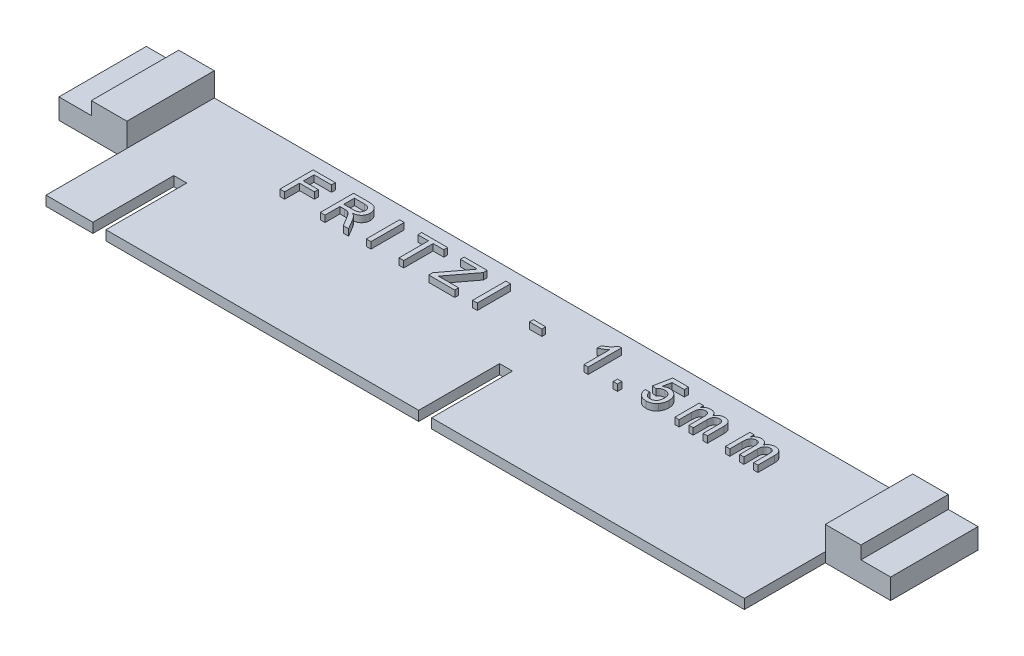
from build123d import *

# Parameters (mm, degrees)
BOSS_EXTRUDE1_DEPTH = 1.5
SKETCH2_W           = 10.09
SKETCH2_H           = 13.5
BOSS_EXTRUDE2_DEPTH = 1.65
SKETCH3_W           = 10.5
SKETCH3_H           = 13.5
BOSS_EXTRUDE3_DEPTH = 1.65
SKETCH6_W           = 5.497902349
SKETCH6_H           = 13.5
BOSS_EXTRUDE4_DEPTH = 2
SKETCH7_W           = 5.501620936
SKETCH7_H           = 13.5
BOSS_EXTRUDE5_DEPTH = 2
WRAP4_OUTLINE_W     = 0.724397578
WRAP4_OUTLINE_H     = 5.13663737
WRAP4_OUTLINE_W_2   = 0.658543252
WRAP4_OUTLINE_H_2   = 0.658543252
WRAP4_OUTLINE_W_3   = 1.909775433
WRAP4_OUTLINE_H_3   = 0.592688927
WRAP4_DEPTH         = 1


# Read off the part's stored shape, not the designer's step: Wrap4
with BuildPart() as part:
    # Sketch1 → Boss-Extrude1 (new body)
    with BuildSketch(Plane(origin=(0, 0, 0), x_dir=(1, 0, 0), z_dir=(0, 1, 0))):
        Polygon((0, 0), (128.5, 0), (128.5, -13.5), (118.41, -13.5), (118.41, -26), (70.08, -26), (70.08, -13.5), (68.08, -13.5), (68.08, -26), (19.75, -26), (19.75, -13.5), (17.75, -13.5), (17.75, -26), (10.5, -26), (10.5, -13.5), (0, -13.5), align=None)
    extrude(amount=BOSS_EXTRUDE1_DEPTH)

    # Sketch2 → Boss-Extrude2 (add)
    with BuildSketch(Plane(origin=(0, 1.5, 0), x_dir=(1, 0, 0), z_dir=(0, 1, 0))):
        with Locations((123.455, -6.75)):
            Rectangle(SKETCH2_W, SKETCH2_H)
    extrude(amount=BOSS_EXTRUDE2_DEPTH)

    # Sketch3 → Boss-Extrude3 (add)
    with BuildSketch(Plane(origin=(0, 1.5, 0), x_dir=(1, 0, 0), z_dir=(0, 1, 0))):
        with Locations((5.25, -6.75)):
            Rectangle(SKETCH3_W, SKETCH3_H)
    extrude(amount=BOSS_EXTRUDE3_DEPTH)

    # Sketch6 → Boss-Extrude4 (add)
    with BuildSketch(Plane(origin=(0, 3.15, 0), x_dir=(1, 0, 0), z_dir=(0, 1, 0))):
        with Locations((7.751048825, -6.75)):
            Rectangle(SKETCH6_W, SKETCH6_H)
    extrude(amount=BOSS_EXTRUDE4_DEPTH)

    # Sketch7 → Boss-Extrude5 (add)
    with BuildSketch(Plane(origin=(0, 3.15, 0), x_dir=(1, 0, 0), z_dir=(0, 1, 0))):
        with Locations((121.160810468, -6.75)):
            Rectangle(SKETCH7_W, SKETCH7_H)
    extrude(amount=BOSS_EXTRUDE5_DEPTH)

    # Wrap4 outline → Wrap4 (add)
    # profile 1 of 12: a face of its own
    with BuildSketch(Plane(origin=(0, 1.5, 0), x_dir=(1, 0, 0), z_dir=(0, 1, 0))):
        with BuildLine():
            add(Edge.make_bspline(
                [(37.232087747, -2.980118824), (37.284568157, -2.98053003), (37.386137849, -2.981325871), (37.533434874, -2.986959518), (37.670921881, -2.999104184), (37.798851661, -3.012236948), (37.917201486, -3.032393986), (38.025849258, -3.055513653), (38.124962722, -3.083026406), (38.214984976, -3.115521089), (38.298505999, -3.152283955), (38.375923678, -3.197643396), (38.450456167, -3.247347671), (38.519337305, -3.305742778), (38.584383838, -3.369680014), (38.645535481, -3.440028151), (38.70188693, -3.517397669), (38.771389695, -3.628129494), (38.84595199, -3.775600966), (38.908074094, -3.964332497), (38.948129316, -4.161752567), (38.952415339, -4.296666315), (38.954589942, -4.365117602)],
                knots=[0, 0, 0, 0, 0.062112751, 0.120211959, 0.174385121, 0.225443756, 0.272358213, 0.316388163, 0.356869479, 0.393978324, 0.429589372, 0.464683041, 0.500036346, 0.535482748, 0.571363467, 0.607908532, 0.645662299, 0.68451734, 0.762578622, 0.840497289, 0.919072993, 1, 1, 1, 1], degree=3))
            Line((37.232087747, -2.980118824), (35.003330427, -2.980118824))
            Line((35.003330427, -2.980118824), (35.003330427, -8.116756194))
            Line((35.003330427, -8.116756194), (35.727728004, -8.116756194))
            Line((35.727728004, -8.116756194), (35.727728004, -5.81185481))
            Line((35.727728004, -5.81185481), (36.469618137, -5.81185481))
            add(Edge.make_bspline(
                [(36.826672057, -5.835521208), (36.805793105, -5.831756024), (36.758125833, -5.823159995), (36.677186923, -5.817545914), (36.579119504, -5.811587319), (36.508048375, -5.811760932), (36.469618137, -5.81185481)],
                knots=[0, 0, 0, 0, 0.177494657, 0.405225623, 0.678388108, 1, 1, 1, 1], degree=3))
            add(Edge.make_bspline(
                [(37.905036633, -7.032217775), (37.882024667, -6.994165441), (37.837431254, -6.920426266), (37.773017668, -6.81273375), (37.709862264, -6.713585631), (37.651286707, -6.6201482), (37.594913903, -6.534117768), (37.541288545, -6.455195483), (37.491886427, -6.382345986), (37.430695517, -6.297530214), (37.35947946, -6.203680775), (37.276375209, -6.107033575), (37.197235321, -6.02997805), (37.09977309, -5.954416911), (36.979051371, -5.883742166), (36.876435632, -5.851269063), (36.826672057, -5.835521208)],
                knots=[0, 0, 0, 0, 0.080781471, 0.156541226, 0.227934987, 0.294310317, 0.356867864, 0.414758559, 0.467641397, 0.516748422, 0.604729742, 0.681570653, 0.748109542, 0.8049411, 0.90540605, 1, 1, 1, 1], degree=3))
            Line((37.905036633, -7.032217775), (38.545058357, -8.116756194))
            Line((38.545058357, -8.116756194), (39.375440239, -8.116756194))
            Line((39.375440239, -8.116756194), (38.532710671, -6.698830254))
            add(Edge.make_bspline(
                [(37.991470435, -5.999128048), (38.03999496, -6.046696262), (38.139667781, -6.144404755), (38.277021257, -6.31083094), (38.41019017, -6.496088821), (38.491100326, -6.62997532), (38.532710671, -6.698830254)],
                knots=[0, 0, 0, 0, 0.22952757, 0.471465934, 0.728186348, 1, 1, 1, 1], degree=3))
            add(Edge.make_bspline(
                [(37.592228588, -5.746000485), (37.633583206, -5.766891926), (37.712117113, -5.806565523), (37.820848281, -5.86877338), (37.913015928, -5.93233448), (37.966413317, -5.977795248), (37.991470435, -5.999128048)],
                knots=[0, 0, 0, 0, 0.293076243, 0.556562337, 0.791913609, 1, 1, 1, 1], degree=3))
            add(Edge.make_bspline(
                [(38.954589942, -4.365117602), (38.953584791, -4.409057224), (38.95159955, -4.49584099), (38.9363924, -4.623436355), (38.90887629, -4.745348596), (38.873592302, -4.862645397), (38.825299287, -4.973664851), (38.769353926, -5.080674564), (38.700045577, -5.180734694), (38.622447216, -5.276509681), (38.533462705, -5.365948281), (38.43230925, -5.445823769), (38.31998956, -5.517671931), (38.195974656, -5.579510447), (38.061692074, -5.636033787), (37.915456937, -5.681549103), (37.757859436, -5.718715849), (37.648605523, -5.736713422), (37.592228588, -5.746000485)],
                knots=[0, 0, 0, 0, 0.061413069, 0.121295023, 0.179224042, 0.235938095, 0.292216833, 0.348196639, 0.404444739, 0.462025534, 0.520334212, 0.580382902, 0.641825905, 0.70636321, 0.773851394, 0.845266257, 0.920154676, 1, 1, 1, 1], degree=3))
        make_face()
        with BuildLine():
            add(Edge.make_bspline(
                [(37.103466018, -5.219165883), (37.172450733, -5.218086552), (37.301411188, -5.216068843), (37.481741982, -5.198839732), (37.635423942, -5.171461944), (37.765495142, -5.131528232), (37.87477548, -5.07608698), (37.969818667, -5.008521454), (38.048800752, -4.923888599), (38.114505688, -4.828398441), (38.165579482, -4.723316289), (38.202421681, -4.612942895), (38.226535542, -4.498205875), (38.228962627, -4.420117448), (38.230192364, -4.38055221)],
                knots=[0, 0, 0, 0, 0.128860268, 0.240892185, 0.338044202, 0.420120485, 0.494058457, 0.566094784, 0.636804954, 0.709148449, 0.781941806, 0.854285301, 0.926170407, 1, 1, 1, 1], degree=3))
            Line((37.103466018, -5.219165883), (35.727728004, -5.219165883))
            Line((35.727728004, -5.219165883), (35.727728004, -3.572807752))
            Line((35.727728004, -3.572807752), (37.258841066, -3.572807752))
            add(Edge.make_bspline(
                [(38.230192364, -4.38055221), (38.229236295, -4.351719516), (38.227363637, -4.29524474), (38.217546542, -4.212355447), (38.19845978, -4.13359146), (38.173255757, -4.058536424), (38.139578067, -3.987740062), (38.099570346, -3.920653781), (38.051828784, -3.8576494), (37.997143572, -3.798534999), (37.934355011, -3.744746671), (37.862635712, -3.69833901), (37.782551323, -3.65890251), (37.694008757, -3.627603068), (37.597286941, -3.602568609), (37.491835257, -3.58591399), (37.37813596, -3.573862764), (37.299348941, -3.573165993), (37.258841066, -3.572807752)],
                knots=[0, 0, 0, 0, 0.060325529, 0.118159991, 0.174186676, 0.229538818, 0.283449815, 0.337826512, 0.392632103, 0.448465576, 0.505965409, 0.565058532, 0.626654479, 0.692232033, 0.761131078, 0.835309877, 0.91532556, 1, 1, 1, 1], degree=3))
        make_face(mode=Mode.SUBTRACT)
    # profile 2 of 12: a face of its own
    with BuildSketch(Plane(origin=(0, 1.5, 0), x_dir=(1, 0, 0), z_dir=(0, 1, 0))):
        with BuildLine():
            add(Edge.make_bspline(
                [(54.28588845, -4.162409757), (54.328869665, -4.106240627), (54.411287551, -3.998534479), (54.52769542, -3.842905303), (54.635307308, -3.703597601), (54.702027272, -3.614721343), (54.733492067, -3.572807752)],
                knots=[0, 0, 0, 0, 0.286630334, 0.549623057, 0.787604526, 1, 1, 1, 1], degree=3))
            Line((54.28588845, -4.162409757), (51.756670771, -7.499371895))
            Line((51.756670771, -7.499371895), (51.756670771, -8.116756194))
            Line((51.756670771, -8.116756194), (55.773784612, -8.116756194))
            Line((55.773784612, -8.116756194), (55.773784612, -7.524067267))
            Line((55.773784612, -7.524067267), (52.64776211, -7.524067267))
            Line((52.64776211, -7.524067267), (52.897802751, -7.193766667))
            Line((52.897802751, -7.193766667), (55.642075961, -3.572807752))
            Line((55.642075961, -3.572807752), (55.642075961, -2.980118824))
            Line((55.642075961, -2.980118824), (52.085942397, -2.980118824))
            Line((52.085942397, -2.980118824), (52.085942397, -3.572807752))
            Line((52.085942397, -3.572807752), (54.733492067, -3.572807752))
        make_face()
    # profile 3 of 12: a face of its own
    with BuildSketch(Plane(origin=(0, 1.5, 0), x_dir=(1, 0, 0), z_dir=(0, 1, 0))):
        with BuildLine():
            add(Edge.make_bspline(
                [(75.727645163, -4.114047987), (75.689726185, -4.150616177), (75.610915743, -4.226619152), (75.477695017, -4.33418234), (75.329003661, -4.443202191), (75.166772527, -4.548036965), (75.001405331, -4.646727599), (74.841599226, -4.735484652), (74.690022243, -4.810594654), (74.590177666, -4.8516651), (74.542267309, -4.871372728)],
                knots=[0, 0, 0, 0, 0.1116703, 0.232094481, 0.362743459, 0.50255751, 0.641525103, 0.771098495, 0.890161757, 1, 1, 1, 1], degree=3))
            Line((75.727645163, -4.114047987), (75.727645163, -8.116756194))
            Line((75.727645163, -8.116756194), (76.386188416, -8.116756194))
            Line((76.386188416, -8.116756194), (76.386188416, -2.980118824))
            Line((76.386188416, -2.980118824), (75.962251197, -2.980118824))
            add(Edge.make_bspline(
                [(74.542267309, -4.264278167), (74.624558299, -4.221898142), (74.786748967, -4.138369624), (75.015889309, -3.994104389), (75.229816467, -3.837714936), (75.4249891, -3.669235889), (75.599948929, -3.497020059), (75.747390118, -3.323247522), (75.870759522, -3.154288028), (75.932656289, -3.036457519), (75.962251197, -2.980118824)],
                knots=[0, 0, 0, 0, 0.142657251, 0.281168994, 0.416977192, 0.550852493, 0.67836417, 0.795032443, 0.901998178, 1, 1, 1, 1], degree=3))
            Line((74.542267309, -4.264278167), (74.542267309, -4.871372728))
        make_face()
    # profile 4 of 12: a face of its own
    with BuildSketch(Plane(origin=(0, 1.5, 0), x_dir=(1, 0, 0), z_dir=(0, 1, 0))):
        with BuildLine():
            add(Edge.make_bspline(
                [(84.459928692, -6.667961039), (84.466449304, -6.705066337), (84.479132909, -6.777241912), (84.503302919, -6.881718198), (84.534692882, -6.978779589), (84.569962962, -7.06926669), (84.611887402, -7.152222714), (84.65731288, -7.228957494), (84.710882947, -7.296747184), (84.767204681, -7.359137248), (84.829022087, -7.414113929), (84.896931657, -7.460461167), (84.96903867, -7.500896326), (85.046221362, -7.534002838), (85.128598024, -7.558235061), (85.215120222, -7.57739859), (85.306902086, -7.587055001), (85.369524225, -7.588953843), (85.401439748, -7.589921592)],
                knots=[0, 0, 0, 0, 0.077361337, 0.150479832, 0.219977237, 0.286680997, 0.349678494, 0.410679625, 0.469427114, 0.526755701, 0.583141981, 0.638824428, 0.69526347, 0.752695805, 0.810849183, 0.871356304, 0.934436431, 1, 1, 1, 1], degree=3))
            Line((84.459928692, -6.667961039), (83.80138544, -6.733815364))
            add(Edge.make_bspline(
                [(85.397323853, -8.182610519), (85.342046321, -8.181489224), (85.233912372, -8.179295744), (85.075585031, -8.160226672), (84.924997008, -8.129818226), (84.782101125, -8.086203101), (84.646466875, -8.031091309), (84.519670831, -7.961080436), (84.399512583, -7.880992357), (84.288635212, -7.788359574), (84.187611491, -7.685038409), (84.097092186, -7.573218014), (84.018302268, -7.452825475), (83.951279766, -7.324581193), (83.895419606, -7.188608159), (83.852684375, -7.043978304), (83.818834515, -6.892110671), (83.807262784, -6.787133721), (83.80138544, -6.733815364)],
                knots=[0, 0, 0, 0, 0.069298023, 0.135560844, 0.199670956, 0.261716238, 0.32266193, 0.382906924, 0.443032033, 0.503500787, 0.563724281, 0.623980022, 0.683629387, 0.743848272, 0.805191846, 0.867648743, 0.932778084, 1, 1, 1, 1], degree=3))
            add(Edge.make_bspline(
                [(86.701033698, -7.559052377), (86.660683807, -7.608803255), (86.581311238, -7.706668572), (86.443878502, -7.833691896), (86.296136362, -7.94164424), (86.137205587, -8.029347696), (85.968153131, -8.099824849), (85.78690223, -8.146724749), (85.59564299, -8.178219889), (85.46433981, -8.181126839), (85.397323853, -8.182610519)],
                knots=[0, 0, 0, 0, 0.127892619, 0.251578514, 0.37279282, 0.492777699, 0.613590069, 0.737808649, 0.866179902, 1, 1, 1, 1], degree=3))
            add(Edge.make_bspline(
                [(87.094101702, -6.355152994), (87.092935688, -6.412138125), (87.090632477, -6.52470002), (87.07175719, -6.690580781), (87.040664639, -6.850419951), (86.999040293, -7.004690862), (86.942800217, -7.152517376), (86.874586267, -7.294376983), (86.795897651, -7.431749942), (86.732793464, -7.516432442), (86.701033698, -7.559052377)],
                knots=[0, 0, 0, 0, 0.132461622, 0.261649501, 0.387546698, 0.510781629, 0.632675361, 0.754660354, 0.87652278, 1, 1, 1, 1], degree=3))
            add(Edge.make_bspline(
                [(85.586655038, -4.692331281), (85.638518088, -4.693690134), (85.740649012, -4.696366045), (85.891142465, -4.718352025), (86.035039521, -4.755674684), (86.173468898, -4.805942864), (86.304605242, -4.872581923), (86.429776871, -4.953267674), (86.548478422, -5.048665187), (86.660038843, -5.156974507), (86.761228581, -5.277209238), (86.851796699, -5.40544809), (86.925767791, -5.544258052), (86.987982556, -5.69001477), (87.034906264, -5.845110896), (87.070522996, -6.007345298), (87.089566081, -6.178746276), (87.092566166, -6.295430443), (87.094101702, -6.355152994)],
                knots=[0, 0, 0, 0, 0.061997419, 0.122087954, 0.181375311, 0.239508008, 0.297835698, 0.356879971, 0.417281825, 0.479640409, 0.542500067, 0.60496242, 0.666991033, 0.730216243, 0.794172863, 0.860458143, 0.92857818, 1, 1, 1, 1], degree=3))
            add(Edge.make_bspline(
                [(84.670868328, -5.034979567), (84.707204981, -5.007712033), (84.778564419, -4.95416291), (84.889872353, -4.884047392), (85.002771873, -4.824944686), (85.116605763, -4.776544539), (85.232278255, -4.73884091), (85.349091326, -4.71264617), (85.467442707, -4.694942223), (85.546804288, -4.693204077), (85.586655038, -4.692331281)],
                knots=[0, 0, 0, 0, 0.136729402, 0.268514917, 0.395529405, 0.519999954, 0.640496477, 0.761236102, 0.880106717, 1, 1, 1, 1], degree=3))
            Line((84.670868328, -5.034979567), (84.932227681, -3.704516402))
            Line((84.932227681, -3.704516402), (86.830684401, -3.704516402))
            Line((86.830684401, -3.704516402), (86.830684401, -3.04597315))
            Line((86.830684401, -3.04597315), (84.394074367, -3.04597315))
            Line((84.394074367, -3.04597315), (83.867239765, -5.68014616))
            Line((83.867239765, -5.68014616), (84.525783017, -5.746000485))
            add(Edge.make_bspline(
                [(85.40452667, -5.285020208), (85.353314748, -5.286518257), (85.255101871, -5.289391176), (85.113980066, -5.31356001), (84.985511777, -5.352601683), (84.871151519, -5.410788547), (84.76897628, -5.480302313), (84.676863423, -5.558960293), (84.594053385, -5.646709307), (84.548628708, -5.71277413), (84.525783017, -5.746000485)],
                knots=[0, 0, 0, 0, 0.147859637, 0.283561322, 0.412369396, 0.534236356, 0.652691629, 0.768663059, 0.883652402, 1, 1, 1, 1], degree=3))
            add(Edge.make_bspline(
                [(86.43555845, -6.394253999), (86.434802473, -6.352379978), (86.433330412, -6.270841548), (86.420933252, -6.152108036), (86.400017784, -6.040462603), (86.372955127, -5.934674721), (86.335652668, -5.836397456), (86.29140985, -5.744205884), (86.23721054, -5.66005658), (86.17691023, -5.581329442), (86.108039664, -5.510753735), (86.029668411, -5.451161489), (85.944870929, -5.39900624), (85.851939311, -5.356711586), (85.750818833, -5.325288247), (85.642514355, -5.301110816), (85.525902056, -5.288394477), (85.44571197, -5.286165171), (85.40452667, -5.285020208)],
                knots=[0, 0, 0, 0, 0.072865933, 0.141886872, 0.207452626, 0.27043768, 0.331640872, 0.390107577, 0.448069287, 0.505502952, 0.562488153, 0.619084329, 0.676415531, 0.73545236, 0.796240769, 0.860405678, 0.928304927, 1, 1, 1, 1], degree=3))
            add(Edge.make_bspline(
                [(85.401439748, -7.589921592), (85.440592946, -7.588975537), (85.51715873, -7.587125486), (85.628547442, -7.571478493), (85.733763102, -7.545678414), (85.832302268, -7.50957312), (85.925320122, -7.464671915), (86.009730853, -7.406533033), (86.090136999, -7.341179186), (86.161364406, -7.263264857), (86.226201359, -7.178442095), (86.282160523, -7.085854442), (86.329270234, -6.98680144), (86.36893146, -6.881302078), (86.398218382, -6.768753675), (86.419761279, -6.649754967), (86.433590959, -6.524230152), (86.434893319, -6.438193762), (86.43555845, -6.394253999)],
                knots=[0, 0, 0, 0, 0.065801038, 0.128676796, 0.188675875, 0.247598437, 0.30484942, 0.361785899, 0.419522706, 0.478681815, 0.538769503, 0.598799056, 0.660184282, 0.722951531, 0.787992689, 0.855403768, 0.926153061, 1, 1, 1, 1], degree=3))
        make_face()
    # profile 5 of 12: a face of its own
    with BuildSketch(Plane(origin=(0, 1.5, 0), x_dir=(1, 0, 0), z_dir=(0, 1, 0))):
        with BuildLine():
            add(Edge.make_bspline(
                [(90.447733216, -4.948545765), (90.476723239, -4.901063826), (90.533920459, -4.807382117), (90.640002493, -4.682214873), (90.757638125, -4.570285777), (90.888267986, -4.473016481), (91.031674921, -4.394320962), (91.185815313, -4.337326372), (91.350061132, -4.303612122), (91.462486911, -4.299371708), (91.519923949, -4.297205329)],
                knots=[0, 0, 0, 0, 0.126604642, 0.249790539, 0.372524359, 0.496014844, 0.619831372, 0.743965703, 0.869195023, 1, 1, 1, 1], degree=3))
            Line((90.447733216, -4.948545765), (90.447733216, -4.363059655))
            Line((90.447733216, -4.363059655), (89.789189963, -4.363059655))
            Line((89.789189963, -4.363059655), (89.789189963, -8.116756194))
            Line((89.789189963, -8.116756194), (90.447733216, -8.116756194))
            Line((90.447733216, -8.116756194), (90.447733216, -6.204922814))
            add(Edge.make_bspline(
                [(91.330592764, -4.889894257), (91.288588619, -4.891246221), (91.205407596, -4.893923522), (91.083929913, -4.922390355), (90.967126463, -4.965849773), (90.856538413, -5.026251305), (90.754817901, -5.102943027), (90.668285592, -5.198594017), (90.597128949, -5.310131821), (90.550101533, -5.41455339), (90.52031038, -5.507244038), (90.50110931, -5.585345371), (90.484771617, -5.67054308), (90.471682199, -5.763305315), (90.459905556, -5.86307666), (90.453684115, -5.970610598), (90.447632981, -6.085152472), (90.447699049, -6.164096924), (90.447733216, -6.204922814)],
                knots=[0, 0, 0, 0, 0.069873516, 0.138370882, 0.206732215, 0.277064656, 0.347591873, 0.41798234, 0.490745669, 0.567227227, 0.608072941, 0.652844181, 0.701152527, 0.752556338, 0.808915673, 0.868486814, 0.931988344, 1, 1, 1, 1], degree=3))
            add(Edge.make_bspline(
                [(91.962382697, -5.722334087), (91.962134017, -5.688702266), (91.961653786, -5.623755159), (91.953820311, -5.529364802), (91.943339345, -5.441238055), (91.926585259, -5.359859524), (91.906417342, -5.284951053), (91.88039988, -5.216968381), (91.850843391, -5.154551486), (91.815611477, -5.098614368), (91.775602282, -5.048772598), (91.729452052, -5.005921969), (91.67774561, -4.96945988), (91.619216954, -4.94074589), (91.555261986, -4.918236513), (91.485592826, -4.901885103), (91.410152735, -4.891212913), (91.357727736, -4.890344002), (91.330592764, -4.889894257)],
                knots=[0, 0, 0, 0, 0.084109515, 0.16242563, 0.236821856, 0.305986647, 0.370107802, 0.430667946, 0.48785122, 0.542607322, 0.595676743, 0.647283062, 0.699654171, 0.753378583, 0.809829663, 0.868937728, 0.932162686, 1, 1, 1, 1], degree=3))
            Line((91.962382697, -5.722334087), (91.962382697, -8.116756194))
            Line((91.962382697, -8.116756194), (92.620925949, -8.116756194))
            Line((92.620925949, -8.116756194), (92.620925949, -5.97546165))
            add(Edge.make_bspline(
                [(93.497611654, -4.889894257), (93.46669128, -4.89061869), (93.405967946, -4.892041376), (93.317228409, -4.90519748), (93.232024674, -4.923899301), (93.1517043, -4.953463308), (93.074727138, -4.989638419), (93.001548223, -5.033604489), (92.933211686, -5.087188157), (92.868348552, -5.14738664), (92.808794264, -5.216665143), (92.758198737, -5.296838716), (92.716685622, -5.386805378), (92.681135702, -5.485873166), (92.653926554, -5.594451232), (92.634391542, -5.712819777), (92.623365713, -5.840798939), (92.621759033, -5.929479606), (92.620925949, -5.97546165)],
                knots=[0, 0, 0, 0, 0.058561161, 0.115006013, 0.169721288, 0.223592136, 0.276804, 0.330761059, 0.384979829, 0.441086797, 0.498267966, 0.557596164, 0.620114805, 0.685704239, 0.7568084, 0.831934894, 0.912856125, 1, 1, 1, 1], degree=3))
            add(Edge.make_bspline(
                [(94.13557543, -5.795391229), (94.134624776, -5.737425092), (94.132862373, -5.629962601), (94.124427168, -5.481525583), (94.10475843, -5.359443045), (94.079970584, -5.25956041), (94.042996174, -5.177003121), (93.995624791, -5.105118211), (93.934188697, -5.04261893), (93.862667378, -4.988728736), (93.782180674, -4.944073749), (93.693741255, -4.911901732), (93.597863371, -4.893228408), (93.531650925, -4.891026328), (93.497611654, -4.889894257)],
                knots=[0, 0, 0, 0, 0.136424945, 0.252916018, 0.349371206, 0.427088741, 0.494280305, 0.561204781, 0.628551254, 0.699408537, 0.771287896, 0.844304451, 0.919958207, 1, 1, 1, 1], degree=3))
            Line((94.13557543, -5.795391229), (94.13557543, -8.116756194))
            Line((94.13557543, -8.116756194), (94.794118683, -8.116756194))
            Line((94.794118683, -8.116756194), (94.794118683, -5.552553405))
            add(Edge.make_bspline(
                [(93.656073624, -4.297205329), (93.70036252, -4.298212006), (93.786780287, -4.300176263), (93.912377513, -4.314872241), (94.030420239, -4.337861795), (94.140216998, -4.372308455), (94.242439001, -4.415325971), (94.337100396, -4.467887534), (94.422778158, -4.531233222), (94.5008838, -4.603730594), (94.570024479, -4.686888616), (94.631258634, -4.779671009), (94.681583355, -4.883706147), (94.722324552, -4.997719526), (94.75580034, -5.121444492), (94.777267382, -5.256310621), (94.792539195, -5.400943083), (94.793582224, -5.501060345), (94.794118683, -5.552553405)],
                knots=[0, 0, 0, 0, 0.068492685, 0.133644899, 0.1953466, 0.254247505, 0.311303505, 0.366649075, 0.421298575, 0.475728728, 0.531092097, 0.588187551, 0.647269778, 0.709369376, 0.775260514, 0.845213034, 0.920388809, 1, 1, 1, 1], degree=3))
            add(Edge.make_bspline(
                [(92.518028566, -4.993820614), (92.554462012, -4.938317502), (92.625091092, -4.830720386), (92.749429392, -4.689674465), (92.878648046, -4.5673878), (93.018047997, -4.468667544), (93.165678143, -4.391283334), (93.32195809, -4.336584712), (93.48665982, -4.303942875), (93.598990266, -4.299475521), (93.656073624, -4.297205329)],
                knots=[0, 0, 0, 0, 0.14231532, 0.27588936, 0.402454802, 0.523362852, 0.641227946, 0.759024066, 0.877542411, 1, 1, 1, 1], degree=3))
            add(Edge.make_bspline(
                [(91.519923949, -4.297205329), (91.582528408, -4.299096125), (91.702976551, -4.302733929), (91.874540195, -4.338275649), (92.028712281, -4.3961713), (92.165085125, -4.476932713), (92.282147755, -4.579573846), (92.382850607, -4.699142298), (92.462865384, -4.838908923), (92.49935013, -4.941367003), (92.518028566, -4.993820614)],
                knots=[0, 0, 0, 0, 0.142825059, 0.274788943, 0.398010012, 0.517437973, 0.634604445, 0.751948839, 0.87300973, 1, 1, 1, 1], degree=3))
        make_face()
    # profile 6 of 12: a face of its own
    with BuildSketch(Plane(origin=(0, 1.5, 0), x_dir=(1, 0, 0), z_dir=(0, 1, 0))):
        with BuildLine():
            add(Edge.make_bspline(
                [(98.271227056, -4.948545765), (98.300217079, -4.901063826), (98.357414299, -4.807382117), (98.463496333, -4.682214873), (98.581131965, -4.570285777), (98.711761826, -4.473016481), (98.855168761, -4.394320962), (99.009309153, -4.337326372), (99.173554972, -4.303612122), (99.285980752, -4.299371708), (99.343417789, -4.297205329)],
                knots=[0, 0, 0, 0, 0.126604642, 0.249790539, 0.372524359, 0.496014844, 0.619831372, 0.743965703, 0.869195023, 1, 1, 1, 1], degree=3))
            Line((98.271227056, -4.948545765), (98.271227056, -4.363059655))
            Line((98.271227056, -4.363059655), (97.612683803, -4.363059655))
            Line((97.612683803, -4.363059655), (97.612683803, -8.116756194))
            Line((97.612683803, -8.116756194), (98.271227056, -8.116756194))
            Line((98.271227056, -8.116756194), (98.271227056, -6.204922814))
            add(Edge.make_bspline(
                [(99.154086604, -4.889894257), (99.112082459, -4.891246221), (99.028901436, -4.893923522), (98.907423753, -4.922390355), (98.790620303, -4.965849773), (98.680032253, -5.026251305), (98.578311741, -5.102943027), (98.491779432, -5.198594017), (98.420622789, -5.310131821), (98.373595373, -5.41455339), (98.34380422, -5.507244038), (98.32460315, -5.585345371), (98.308265457, -5.67054308), (98.295176039, -5.763305315), (98.283399396, -5.86307666), (98.277177955, -5.970610598), (98.271126821, -6.085152472), (98.271192889, -6.164096924), (98.271227056, -6.204922814)],
                knots=[0, 0, 0, 0, 0.069873516, 0.138370882, 0.206732215, 0.277064656, 0.347591873, 0.41798234, 0.490745669, 0.567227227, 0.608072941, 0.652844181, 0.701152527, 0.752556338, 0.808915673, 0.868486814, 0.931988344, 1, 1, 1, 1], degree=3))
            add(Edge.make_bspline(
                [(99.785876537, -5.722334087), (99.785627857, -5.688702266), (99.785147626, -5.623755159), (99.777314151, -5.529364802), (99.766833186, -5.441238055), (99.750079099, -5.359859524), (99.729911182, -5.284951053), (99.70389372, -5.216968381), (99.674337231, -5.154551486), (99.639105317, -5.098614368), (99.599096122, -5.048772598), (99.552945892, -5.005921969), (99.50123945, -4.96945988), (99.442710794, -4.94074589), (99.378755826, -4.918236513), (99.309086666, -4.901885103), (99.233646575, -4.891212913), (99.181221576, -4.890344002), (99.154086604, -4.889894257)],
                knots=[0, 0, 0, 0, 0.084109515, 0.16242563, 0.236821856, 0.305986647, 0.370107802, 0.430667946, 0.48785122, 0.542607322, 0.595676743, 0.647283062, 0.699654171, 0.753378583, 0.809829663, 0.868937728, 0.932162686, 1, 1, 1, 1], degree=3))
            Line((99.785876537, -5.722334087), (99.785876537, -8.116756194))
            Line((99.785876537, -8.116756194), (100.444419789, -8.116756194))
            Line((100.444419789, -8.116756194), (100.444419789, -5.97546165))
            add(Edge.make_bspline(
                [(101.321105494, -4.889894257), (101.29018512, -4.89061869), (101.229461787, -4.892041376), (101.14072225, -4.90519748), (101.055518514, -4.923899301), (100.97519814, -4.953463308), (100.898220978, -4.989638419), (100.825042063, -5.033604489), (100.756705527, -5.087188157), (100.691842392, -5.14738664), (100.632288104, -5.216665143), (100.581692577, -5.296838716), (100.540179462, -5.386805378), (100.504629543, -5.485873166), (100.477420394, -5.594451232), (100.457885382, -5.712819777), (100.446859554, -5.840798939), (100.445252873, -5.929479606), (100.444419789, -5.97546165)],
                knots=[0, 0, 0, 0, 0.058561161, 0.115006013, 0.169721288, 0.223592136, 0.276804, 0.330761059, 0.384979829, 0.441086797, 0.498267966, 0.557596164, 0.620114805, 0.685704239, 0.7568084, 0.831934894, 0.912856125, 1, 1, 1, 1], degree=3))
            add(Edge.make_bspline(
                [(101.95906927, -5.795391229), (101.958118616, -5.737425092), (101.956356213, -5.629962601), (101.947921008, -5.481525583), (101.92825227, -5.359443045), (101.903464424, -5.25956041), (101.866490014, -5.177003121), (101.819118631, -5.105118211), (101.757682537, -5.04261893), (101.686161219, -4.988728736), (101.605674514, -4.944073749), (101.517235095, -4.911901732), (101.421357211, -4.893228408), (101.355144765, -4.891026328), (101.321105494, -4.889894257)],
                knots=[0, 0, 0, 0, 0.136424945, 0.252916018, 0.349371206, 0.427088741, 0.494280305, 0.561204781, 0.628551254, 0.699408537, 0.771287896, 0.844304451, 0.919958207, 1, 1, 1, 1], degree=3))
            Line((101.95906927, -5.795391229), (101.95906927, -8.116756194))
            Line((101.95906927, -8.116756194), (102.617612523, -8.116756194))
            Line((102.617612523, -8.116756194), (102.617612523, -5.552553405))
            add(Edge.make_bspline(
                [(101.479567464, -4.297205329), (101.52385636, -4.298212006), (101.610274127, -4.300176263), (101.735871353, -4.314872241), (101.853914079, -4.337861795), (101.963710838, -4.372308455), (102.065932841, -4.415325971), (102.160594236, -4.467887534), (102.246271998, -4.531233222), (102.32437764, -4.603730594), (102.39351832, -4.686888616), (102.454752475, -4.779671009), (102.505077195, -4.883706147), (102.545818392, -4.997719526), (102.57929418, -5.121444492), (102.600761223, -5.256310621), (102.616033035, -5.400943083), (102.617076064, -5.501060345), (102.617612523, -5.552553405)],
                knots=[0, 0, 0, 0, 0.068492685, 0.133644899, 0.1953466, 0.254247505, 0.311303505, 0.366649075, 0.421298575, 0.475728728, 0.531092097, 0.588187551, 0.647269778, 0.709369376, 0.775260514, 0.845213034, 0.920388809, 1, 1, 1, 1], degree=3))
            add(Edge.make_bspline(
                [(100.341522406, -4.993820614), (100.377955852, -4.938317502), (100.448584932, -4.830720386), (100.572923232, -4.689674465), (100.702141887, -4.5673878), (100.841541837, -4.468667544), (100.989171983, -4.391283334), (101.14545193, -4.336584712), (101.31015366, -4.303942875), (101.422484106, -4.299475521), (101.479567464, -4.297205329)],
                knots=[0, 0, 0, 0, 0.14231532, 0.27588936, 0.402454802, 0.523362852, 0.641227946, 0.759024066, 0.877542411, 1, 1, 1, 1], degree=3))
            add(Edge.make_bspline(
                [(99.343417789, -4.297205329), (99.406022248, -4.299096125), (99.526470391, -4.302733929), (99.698034035, -4.338275649), (99.852206121, -4.3961713), (99.988578965, -4.476932713), (100.105641595, -4.579573846), (100.206344447, -4.699142298), (100.286359224, -4.838908923), (100.32284397, -4.941367003), (100.341522406, -4.993820614)],
                knots=[0, 0, 0, 0, 0.142825059, 0.274788943, 0.398010012, 0.517437973, 0.634604445, 0.751948839, 0.87300973, 1, 1, 1, 1], degree=3))
        make_face()
    # profile 7 of 12: a face of its own
    with BuildSketch(Plane(origin=(0, 1.5, 0), x_dir=(1, 0, 0), z_dir=(0, 1, 0))):
        Polygon((32.184765306, -2.980118824), (28.760340392, -2.980118824), (28.760340392, -8.116756194), (29.48473797, -8.116756194), (29.48473797, -5.81185481), (31.789639354, -5.81185481), (31.789639354, -5.219165883), (29.48473797, -5.219165883), (29.48473797, -3.572807752), (32.184765306, -3.572807752), align=None)
    # profile 8 of 12: a face of its own
    with BuildSketch(Plane(origin=(0, 1.5, 0), x_dir=(1, 0, 0), z_dir=(0, 1, 0))):
        with Locations((42.464625478, -5.548437509)):
            Rectangle(WRAP4_OUTLINE_W, WRAP4_OUTLINE_H)
    # profile 9 of 12: a face of its own
    with BuildSketch(Plane(origin=(0, 1.5, 0), x_dir=(1, 0, 0), z_dir=(0, 1, 0))):
        Polygon((49.530794577, -2.980118824), (45.513680737, -2.980118824), (45.513680737, -3.572807752), (47.160038868, -3.572807752), (47.160038868, -8.116756194), (47.884436446, -8.116756194), (47.884436446, -3.572807752), (49.530794577, -3.572807752), align=None)
    # profile 10 of 12: a face of its own
    with BuildSketch(Plane(origin=(0, 1.5, 0), x_dir=(1, 0, 0), z_dir=(0, 1, 0))):
        with Locations((58.888694196, -5.548437509)):
            Rectangle(WRAP4_OUTLINE_W, WRAP4_OUTLINE_H)
    # profile 11 of 12: a face of its own
    with BuildSketch(Plane(origin=(0, 1.5, 0), x_dir=(1, 0, 0), z_dir=(0, 1, 0))):
        with Locations((80.587694367, -7.787484568)):
            Rectangle(WRAP4_OUTLINE_W_2, WRAP4_OUTLINE_H_2)
    # profile 12 of 12: a face of its own
    with BuildSketch(Plane(origin=(0, 1.5, 0), x_dir=(1, 0, 0), z_dir=(0, 1, 0))):
        with Locations((66.764871497, -6.30576225)):
            Rectangle(WRAP4_OUTLINE_W_3, WRAP4_OUTLINE_H_3)
    extrude(amount=WRAP4_DEPTH)


solid = part.part
